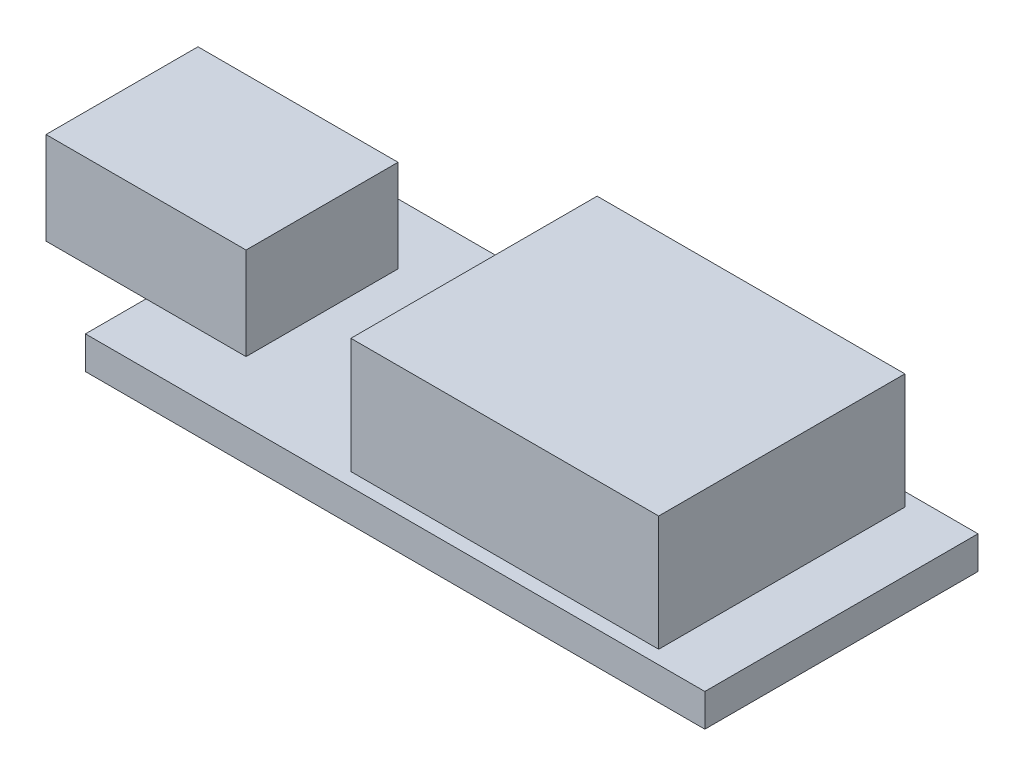
from build123d import *

# Parameters (mm, degrees)
SKETCH1_W           = 32.2
SKETCH1_H           = 14.2
SKETCH1_R           = 1.35
BOSS_EXTRUDE1_DEPTH = 1.7
SKETCH2_W           = 16
SKETCH2_H           = 12.8
BOSS_EXTRUDE2_DEPTH = 6
SKETCH3_W           = 10.4
SKETCH3_H           = 7.9
BOSS_EXTRUDE3_DEPTH = 4.8


with BuildPart() as part:
    # Sketch1 → Boss-Extrude1 (new body)
    with BuildSketch(Plane(origin=(0, 0, 0), x_dir=(1, 0, 0), z_dir=(0, 1, 0))):
        Rectangle(SKETCH1_W, SKETCH1_H)
        with Locations((-5.95, 0)):
            Circle(SKETCH1_R, mode=Mode.SUBTRACT)
    extrude(amount=BOSS_EXTRUDE1_DEPTH)

    # Sketch2 → Boss-Extrude2 (add)
    with BuildSketch(Plane(origin=(0, 1.7, 0), x_dir=(1, 0, 0), z_dir=(0, 1, 0))):
        with Locations((5, 0)):
            Rectangle(SKETCH2_W, SKETCH2_H)
    extrude(amount=BOSS_EXTRUDE2_DEPTH)

    # Sketch3 → Boss-Extrude3 (add)
    with BuildSketch(Plane(origin=(0, 1.7, 0), x_dir=(1, 0, 0), z_dir=(0, 1, 0))):
        with Locations((-16.1, 0)):
            Rectangle(SKETCH3_W, SKETCH3_H)
    extrude(amount=BOSS_EXTRUDE3_DEPTH)


solid = part.part
